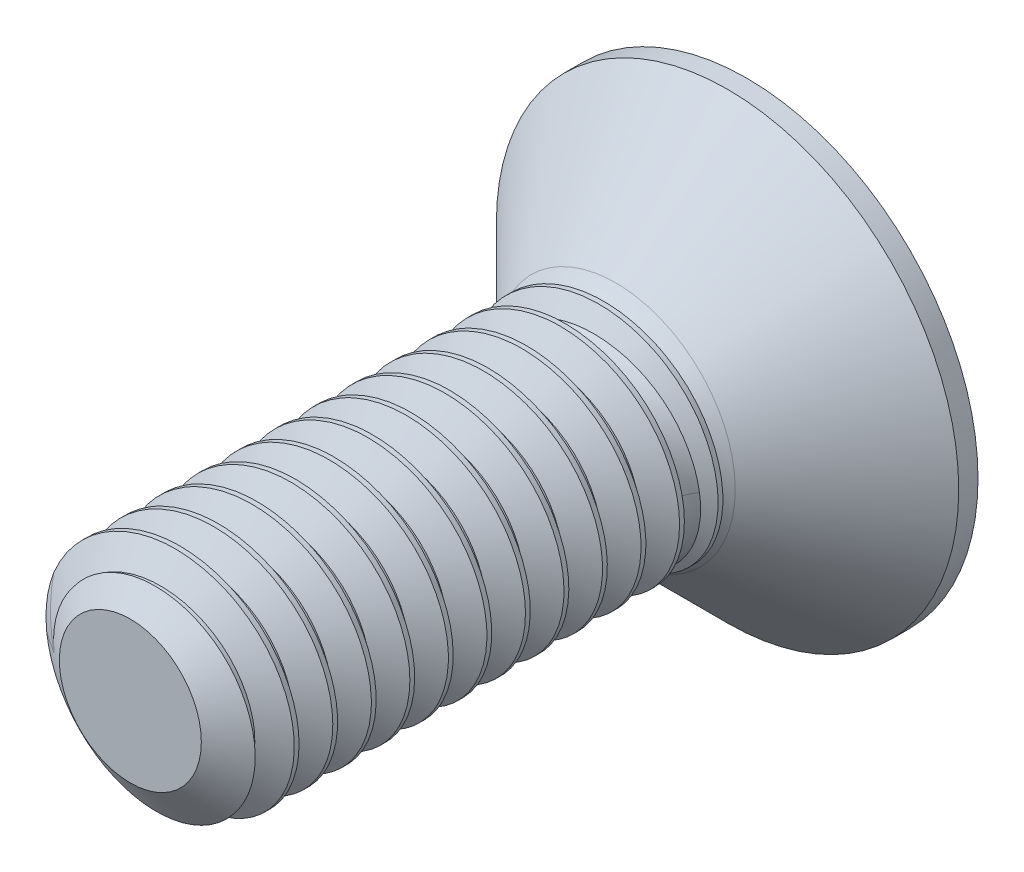
from build123d import *

# Parameters (mm, degrees)
SKETCH1_R          = 1.5
EXTRUDE1_DEPTH     = 8
CUT_SWEEP1_PITCH   = 0.5
SKETCH6_R          = 3
EXTRUDE2_DEPTH     = 1.7
CUT_EXTRUDE1_DEPTH = 1.5
SKETCH8_R          = 1.154700538
CUT_EXTRUDE2_DEPTH = 10.055385226
CUT_EXTRUDE2_TAPER = 45


with BuildPart() as part:
    # Sketch1 → Extrude1 (new body)
    with BuildSketch(Plane.XY):
        Circle(SKETCH1_R)
    extrude(amount=-EXTRUDE1_DEPTH)

    # Cut-Sweep1: arcs per turn and ends read off the stored shape
    # Cut-Sweep1: the profile of Sketch3 profile screwed along a right-hand helix through 19 turns, 6 arcs to a turn; built about Z, then put on its axis
    cut_sweep1_z = Axis((0, 0, 0), (0, 0, 1))
    cut_sweep1_corners = [(1.5003, 0, -0.937673205), (1.175240474, 0, -0.75), (1.175240474, 0, -0.6875), (1.5003, 0, -0.499826795)]
    with BuildLine(mode=Mode.PRIVATE) as cut_sweep1_profile:
        Line(cut_sweep1_corners[0], cut_sweep1_corners[1])
        Line(cut_sweep1_corners[1], cut_sweep1_corners[2])
        Line(cut_sweep1_corners[2], cut_sweep1_corners[3])
        Line(cut_sweep1_corners[3], cut_sweep1_corners[0])
    cut_sweep1_cap = Face(cut_sweep1_profile.wire())
    cut_sweep1_turn_angles = [0, 30, 60, 90, 120, 150, 180, 210, 240, 270, 300, 330, 360]
    cut_sweep1_turn_weights = [1, 0.8660254037844387, 1, 0.8660254037844387, 1, 0.8660254037844387, 1, 0.8660254037844387, 1, 0.8660254037844387, 1, 0.8660254037844387, 1]
    cut_sweep1_turn_rails = [Edge.make_bspline([Vector(p[0], p[1], 0).rotate(cut_sweep1_z, cut_sweep1_turn_angles[k]) / cut_sweep1_turn_weights[k] + Vector(0, 0, p[2] + CUT_SWEEP1_PITCH * cut_sweep1_turn_angles[k] / 360) for k in range(13)], [0, 0, 0, 1, 1, 2, 2, 3, 3, 4, 4, 5, 5, 6, 6, 6], 2, cut_sweep1_turn_weights) for p in cut_sweep1_corners]
    cut_sweep1_turn_sides = [Face.make_surface_from_curves(cut_sweep1_turn_rails[p[0]], cut_sweep1_turn_rails[p[1]]) for p in [(0, 1), (1, 2), (2, 3), (3, 0)]]
    cut_sweep1 = Plane(origin=(0, 0, 0), x_dir=(0, 1, 0), z_dir=(0, 0, -1)) * Solid(Shell([*[p.moved(Location((0, 0, CUT_SWEEP1_PITCH * i))) for i in range(19) for p in cut_sweep1_turn_sides], cut_sweep1_cap, cut_sweep1_cap.rotate(cut_sweep1_z, 6840).moved(Location((0, 0, CUT_SWEEP1_PITCH * 6840 / 360)))]))
    add(cut_sweep1, mode=Mode.SUBTRACT)

    # Sketch4 → Cut-Revolve1 (revolve, cut)
    with BuildSketch(Plane(origin=(0, 0, 0), x_dir=(0, 0, -1), z_dir=(1, 0, 0)), mode=Mode.PRIVATE) as cut_revolve1_sk:
        Polygon((0.405251783, 1.5), (0, 0.921240474), (0, 1.5), align=None)
    revolve(cut_revolve1_sk.sketch.rotate(Axis((0, 0, 0), (0, 0, -1)), 90), axis=Axis((0, 0, 0), (0, 0, -1)), mode=Mode.SUBTRACT)

    # Sketch6 → Extrude2 (add)
    with BuildSketch(Plane(origin=(0, 0, -8), x_dir=(-1, 0, 0), z_dir=(0, 0, -1))):
        Circle(SKETCH6_R)
    extrude(amount=-EXTRUDE2_DEPTH)

    # Sketch10 → Cut-Revolve2 (revolve, cut)
    with BuildSketch(Plane(origin=(0, 0, 0), x_dir=(0, 0, -1), z_dir=(1, 0, 0)), mode=Mode.PRIVATE) as cut_revolve2_sk:
        Polygon((7.75, -3), (6.3, -1.55), (6.3, -3), align=None)
    revolve(cut_revolve2_sk.sketch.rotate(Axis((0, 0, 0), (0, 0, -1)), 270), axis=Axis((0, 0, 0), (0, 0, -1)), mode=Mode.SUBTRACT)

    # Sketch11 → Revolve1 (revolve)
    with BuildSketch(Plane(origin=(0, 0, 0), x_dir=(0, 0, -1), z_dir=(1, 0, 0)), mode=Mode.PRIVATE) as revolve1_sk:
        with BuildLine():
            Line((5.395250469, 1.175240474), (5.395250469, 0))
            Line((5.395250469, 0), (6.3, 0))
            Line((6.3, 0), (6.3, 1.55))
            ThreePointArc((6.3, 1.55), (5.884897387, 1.272637301), (5.395250469, 1.175240474))
        make_face()
    revolve(revolve1_sk.sketch.rotate(Axis((0, 0, 0), (0, 0, -1)), 90), axis=Axis((0, 0, 0), (0, 0, -1)))

    # Sketch7 → Cut-Extrude1 (cut)
    with BuildSketch(Plane.XY.offset(-8)):
        Polygon((0, 1.154700538), (-1, 0.577350269), (-1, -0.577350269), (0, -1.154700538), (1, -0.577350269), (1, 0.577350269), align=None)
    extrude(amount=CUT_EXTRUDE1_DEPTH, mode=Mode.SUBTRACT)

    # Sketch8 → Cut-Extrude2 (cut, through all)
    with BuildSketch(Plane.XY.offset(-8)):
        Circle(SKETCH8_R)
    extrude(amount=CUT_EXTRUDE2_DEPTH, taper=CUT_EXTRUDE2_TAPER, mode=Mode.SUBTRACT)


solid = part.part
